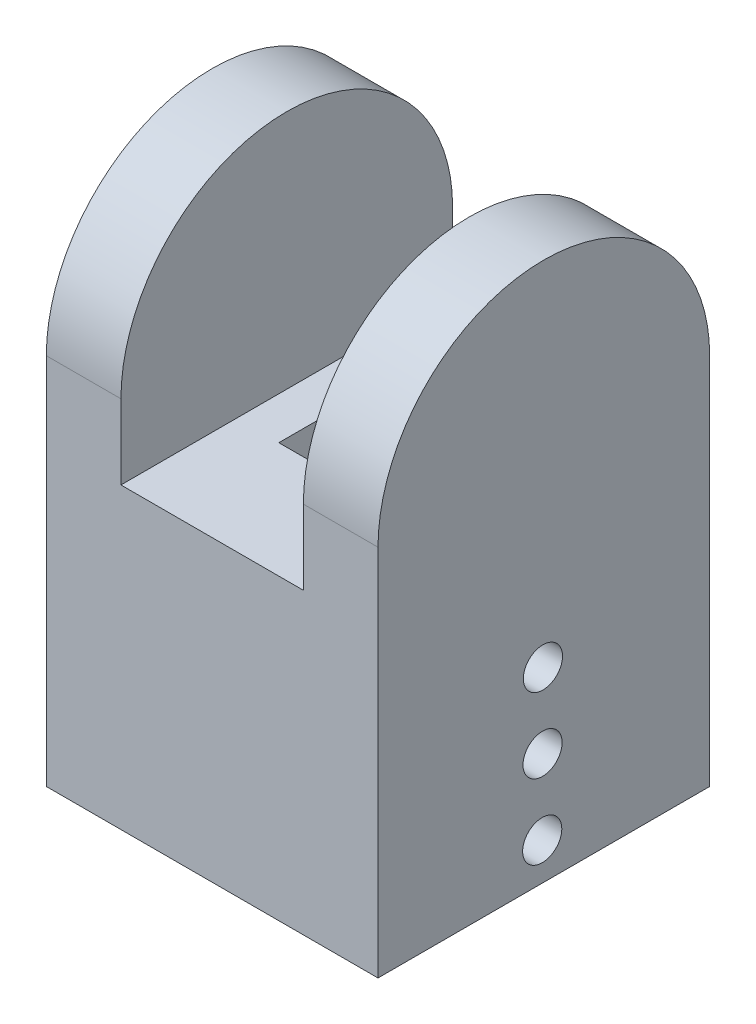
from build123d import *

# Parameters (mm, degrees)
SKETCH1_W           = 88.9
SKETCH1_H           = 88.9
BOSS_EXTRUDE1_DEPTH = 100
SKETCH2_R           = 5.25
CUT_EXTRUDE1_DEPTH  = 101
BOSS_EXTRUDE2_DEPTH = 20
BOSS_EXTRUDE3_START = -20
BOSS_EXTRUDE3_DEPTH = 20
SKETCH5_W           = 48.9
SKETCH5_H           = 20
CUT_EXTRUDE2_DEPTH  = 120


with BuildPart() as part:
    # Sketch1 → Boss-Extrude1 (new body)
    with BuildSketch(Plane(origin=(0, 0, 0), x_dir=(1, 0, 0), z_dir=(0, 1, 0))):
        with Locations((-2.222691481, 0.481565949)):
            Rectangle(SKETCH1_W, SKETCH1_H)
        Polygon((10.877308519, 13.2), (10.877308519, 0), (10.877308519, -13), (-15.322691481, -13), (-15.322691481, 13.2), align=None, mode=Mode.SUBTRACT)
    extrude(amount=BOSS_EXTRUDE1_DEPTH)

    # Sketch2 → Cut-Extrude1 (cut)
    with BuildSketch(Plane(origin=(42.227308519, 0, 0), x_dir=(0, 0, -1), z_dir=(1, 0, 0))):
        with Locations((0.240781858, 49.999768098)):
            Circle(SKETCH2_R)
        with Locations((0.048156595, 10)):
            Circle(SKETCH2_R)
        with Locations((0.144469785, 30)):
            Circle(SKETCH2_R)
    extrude(amount=-CUT_EXTRUDE1_DEPTH, mode=Mode.SUBTRACT)

    # Sketch3 → Boss-Extrude2 (add)
    with BuildSketch(Plane(origin=(42.227308519, 0, 0), x_dir=(0, 0, -1), z_dir=(1, 0, 0))):
        with BuildLine():
            Line((-43.968434051, 100), (44.931565949, 100))
            ThreePointArc((44.931565949, 100), (0.481565949, 144.45), (-43.968434051, 100))
        make_face()
    extrude(amount=-BOSS_EXTRUDE2_DEPTH)

    # Sketch4 → Boss-Extrude3 (add)
    with BuildSketch(Plane.ZY.offset(46.672691481).offset(BOSS_EXTRUDE3_START)):
        with BuildLine():
            Line((-44.931565949, 100), (43.968434051, 100))
            ThreePointArc((43.968434051, 100), (-0.481565949, 144.45), (-44.931565949, 100))
        make_face()
    extrude(amount=BOSS_EXTRUDE3_DEPTH)

    # Sketch5 → Cut-Extrude2 (cut)
    with BuildSketch(Plane.XY.offset(43.968434051)):
        with Locations((-2.222691481, 90)):
            Rectangle(SKETCH5_W, SKETCH5_H)
    extrude(amount=-CUT_EXTRUDE2_DEPTH, mode=Mode.SUBTRACT)


solid = part.part
